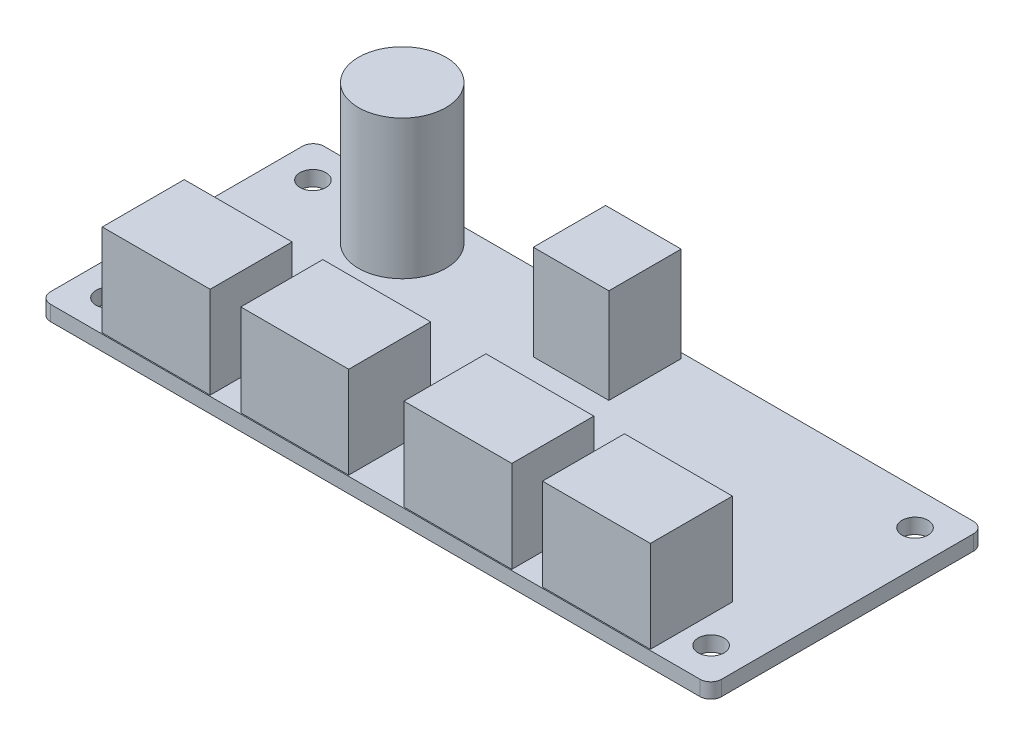
from build123d import *

# Parameters (mm, degrees)
SKETCH1_R           = 1.2
BOSS_EXTRUDE1_DEPTH = 1.4
SKETCH2_W           = 7
SKETCH2_H           = 6.7
BOSS_EXTRUDE2_DEPTH = 8.8
SKETCH3_W           = 10
SKETCH3_H           = 7.6
BOSS_EXTRUDE3_DEPTH = 8.5
SKETCH4_R           = 4.05
BOSS_EXTRUDE4_DEPTH = 12.9


with BuildPart() as part:
    # Sketch1 → Boss-Extrude1 (new body)
    with BuildSketch(Plane(origin=(0, 0, 0), x_dir=(1, 0, 0), z_dir=(0, 1, 0))):
        with BuildLine():
            Line((-30.1, -12.675), (30.1, -12.675))
            ThreePointArc((30.1, -12.675), (30.807106781, -12.382106781), (31.1, -11.675))
            Line((31.1, -11.675), (31.1, 11.675))
            ThreePointArc((31.1, 11.675), (30.807106781, 12.382106781), (30.1, 12.675))
            Line((30.1, 12.675), (-30.1, 12.675))
            ThreePointArc((-30.1, 12.675), (-30.807106781, 12.382106781), (-31.1, 11.675))
            Line((-31.1, 11.675), (-31.1, -11.675))
            ThreePointArc((-31.1, -11.675), (-30.807106781, -12.382106781), (-30.1, -12.675))
        make_face()
        with Locations((-27.9, 9.45)):
            Circle(SKETCH1_R, mode=Mode.SUBTRACT)
        with Locations((-27.9, -9.45)):
            Circle(SKETCH1_R, mode=Mode.SUBTRACT)
        with Locations((27.9, -9.45)):
            Circle(SKETCH1_R, mode=Mode.SUBTRACT)
        with Locations((27.9, 9.45)):
            Circle(SKETCH1_R, mode=Mode.SUBTRACT)
    extrude(amount=BOSS_EXTRUDE1_DEPTH)

    # Sketch2 → Boss-Extrude2 (add)
    with BuildSketch(Plane(origin=(0, 1.4, 0), x_dir=(1, 0, 0), z_dir=(0, 1, 0))):
        with Locations((0, 8.825)):
            Rectangle(SKETCH2_W, SKETCH2_H)
    extrude(amount=BOSS_EXTRUDE2_DEPTH)

    # Sketch3 → Boss-Extrude3 (add)
    with BuildSketch(Plane(origin=(0, 1.4, 0), x_dir=(1, 0, 0), z_dir=(0, 1, 0))):
        with Locations((-20.4, -8.775)):
            Rectangle(SKETCH3_W, SKETCH3_H)
        with Locations((-7.56, -8.775)):
            Rectangle(SKETCH3_W, SKETCH3_H)
    boss_extrude3 = extrude(amount=BOSS_EXTRUDE3_DEPTH)

    # Mirror1: Boss-Extrude3 across plane
    add(boss_extrude3.mirror(Plane(origin=(0, 0, 0), x_dir=(0, 0, 1), z_dir=(1, 0, 0))))

    # Sketch4 → Boss-Extrude4 (add)
    with BuildSketch(Plane(origin=(0, 1.4, 0), x_dir=(1, 0, 0), z_dir=(0, 1, 0))):
        with Locations((-18.7, 8.525)):
            Circle(SKETCH4_R)
    extrude(amount=BOSS_EXTRUDE4_DEPTH)


solid = part.part
